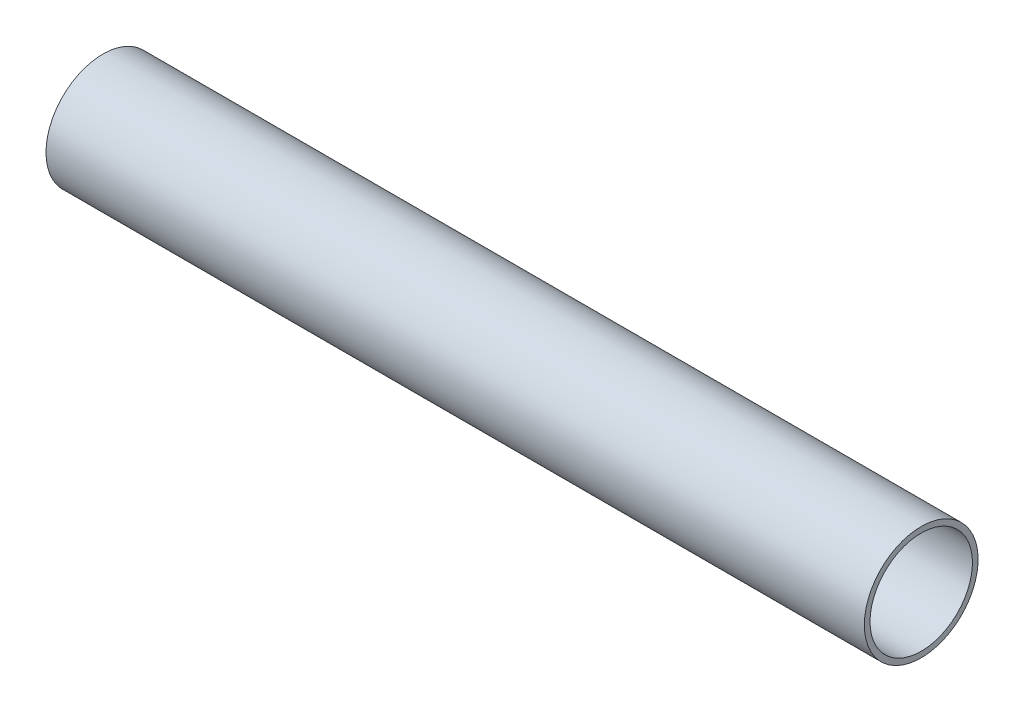
from build123d import *

# Parameters (mm, degrees)
SKETCH1_R           = 15.875
SKETCH1_R_2         = 14.2875
EXTRUDE_THIN1_DEPTH = 114.173


with BuildPart() as part:
    # Sketch1 → Extrude-Thin1 (new, symmetric)
    with BuildSketch(Plane(origin=(0, 0, 0), x_dir=(0, 0, -1), z_dir=(1, 0, 0))):
        Circle(SKETCH1_R)
        Circle(SKETCH1_R_2, mode=Mode.SUBTRACT)
    extrude(amount=EXTRUDE_THIN1_DEPTH, both=True)


solid = part.part
